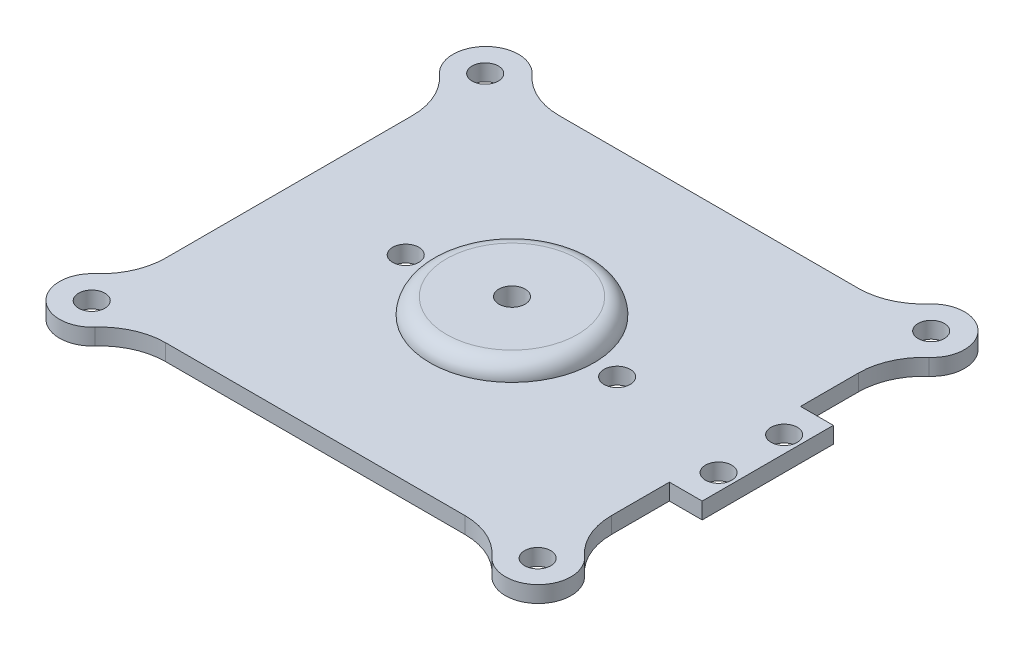
from build123d import *

# Parameters (mm, degrees)
SALIENTE_EXTRUIR1_DEPTH = 5
CROQUIS3_R              = 25
SALIENTE_EXTRUIR2_DEPTH = 5
CORTAR_EXTRUIR1_REACH   = 107.281
CROQUIS4_R              = 4
CORTAR_EXTRUIR2_REACH   = 106.924
CROQUIS5_R              = 4
CORTAR_EXTRUIR8_REACH   = 106.924
CROQUIS12_R             = 4
REDONDEO2_R             = 5


with BuildPart() as part:
    # Croquis1 → Saliente-Extruir1 (new body)
    with BuildSketch(Plane(origin=(0, 0, 0), x_dir=(1, 0, 0), z_dir=(0, 1, 0))):
        with BuildLine():
            Line((78, 60), (78, -60))
            ThreePointArc((78, -60), (75.071067812, -67.071067812), (68, -70))
            Line((68, -70), (-68, -70))
            ThreePointArc((-68, -70), (-75.071067812, -67.071067812), (-78, -60))
            Line((-78, -60), (-78, 60))
            ThreePointArc((-78, 60), (-75.071067812, 67.071067812), (-68, 70))
            Line((-68, 70), (68, 70))
            ThreePointArc((68, 70), (75.071067812, 67.071067812), (78, 60))
        make_face()
    extrude(amount=SALIENTE_EXTRUIR1_DEPTH)

    # Croquis3 → Saliente-Extruir2 (add)
    with BuildSketch(Plane(origin=(0, 5, 0), x_dir=(1, 0, 0), z_dir=(0, 1, 0))):
        with Locations(Location((0, 0, 0), (0, 0, 270))):
            Circle(CROQUIS3_R)
    extrude(amount=SALIENTE_EXTRUIR2_DEPTH)

    # Croquis4 → Cortar-Extruir1 (cut, up to next)
    with BuildSketch(Plane(origin=(0, 10, 0), x_dir=(1, 0, 0), z_dir=(0, 1, 0)), mode=Mode.PRIVATE) as cortar_extruir1_sk1:
        with Locations(Location((0, 0, 0), (0, 0, 270))):
            Circle(CROQUIS4_R)
    cortar_extruir1_tool1 = extrude(cortar_extruir1_sk1.sketch, amount=-CORTAR_EXTRUIR1_REACH, mode=Mode.PRIVATE) & part.part
    add(cortar_extruir1_tool1.solids().sort_by_distance((0, 10, 0))[0], mode=Mode.SUBTRACT)

    # Croquis5 → Cortar-Extruir2 (cut, up to next)
    with BuildSketch(Plane(origin=(0, 5, 0), x_dir=(1, 0, 0), z_dir=(0, 1, 0)), mode=Mode.PRIVATE) as cortar_extruir2_sk1:
        with Locations(Location((-68, -60.171139927, 0), (0, 0, 270))):
            Circle(CROQUIS5_R)
    cortar_extruir2_tool1 = extrude(cortar_extruir2_sk1.sketch, amount=-CORTAR_EXTRUIR2_REACH, mode=Mode.PRIVATE) & part.part
    # Croquis5 → Cortar-Extruir2 (cut, up to next)
    with BuildSketch(Plane(origin=(0, 5, 0), x_dir=(1, 0, 0), z_dir=(0, 1, 0)), mode=Mode.PRIVATE) as cortar_extruir2_sk2:
        with Locations(Location((-68, 59.828860073, 0), (0, 0, 270))):
            Circle(CROQUIS5_R)
    cortar_extruir2_tool2 = extrude(cortar_extruir2_sk2.sketch, amount=-CORTAR_EXTRUIR2_REACH, mode=Mode.PRIVATE) & part.part
    # Croquis5 → Cortar-Extruir2 (cut, up to next)
    with BuildSketch(Plane(origin=(0, 5, 0), x_dir=(1, 0, 0), z_dir=(0, 1, 0)), mode=Mode.PRIVATE) as cortar_extruir2_sk3:
        with Locations(Location((68, -60.171139927, 0), (0, 0, 270))):
            Circle(CROQUIS5_R)
    cortar_extruir2_tool3 = extrude(cortar_extruir2_sk3.sketch, amount=-CORTAR_EXTRUIR2_REACH, mode=Mode.PRIVATE) & part.part
    # Croquis5 → Cortar-Extruir2 (cut, up to next)
    with BuildSketch(Plane(origin=(0, 5, 0), x_dir=(1, 0, 0), z_dir=(0, 1, 0)), mode=Mode.PRIVATE) as cortar_extruir2_sk4:
        with Locations(Location((68, 59.828860073, 0), (0, 0, 270))):
            Circle(CROQUIS5_R)
    cortar_extruir2_tool4 = extrude(cortar_extruir2_sk4.sketch, amount=-CORTAR_EXTRUIR2_REACH, mode=Mode.PRIVATE) & part.part
    # Croquis5 → Cortar-Extruir2 (cut, up to next)
    with BuildSketch(Plane(origin=(0, 5, 0), x_dir=(1, 0, 0), z_dir=(0, 1, 0)), mode=Mode.PRIVATE) as cortar_extruir2_sk5:
        with Locations(Location((32.24, -0.171139927, 0), (0, 0, 270))):
            Circle(CROQUIS5_R)
    cortar_extruir2_tool5 = extrude(cortar_extruir2_sk5.sketch, amount=-CORTAR_EXTRUIR2_REACH, mode=Mode.PRIVATE) & part.part
    # Croquis5 → Cortar-Extruir2 (cut, up to next)
    with BuildSketch(Plane(origin=(0, 5, 0), x_dir=(1, 0, 0), z_dir=(0, 1, 0)), mode=Mode.PRIVATE) as cortar_extruir2_sk6:
        with Locations(Location((-32.24, -0.171139927, 0), (0, 0, 270))):
            Circle(CROQUIS5_R)
    cortar_extruir2_tool6 = extrude(cortar_extruir2_sk6.sketch, amount=-CORTAR_EXTRUIR2_REACH, mode=Mode.PRIVATE) & part.part
    add(cortar_extruir2_tool1.solids().sort_by_distance((-68, 5, 60.17114))[0], mode=Mode.SUBTRACT)
    add(cortar_extruir2_tool2.solids().sort_by_distance((-68, 5, -59.82886))[0], mode=Mode.SUBTRACT)
    add(cortar_extruir2_tool3.solids().sort_by_distance((68, 5, 60.17114))[0], mode=Mode.SUBTRACT)
    add(cortar_extruir2_tool4.solids().sort_by_distance((68, 5, -59.82886))[0], mode=Mode.SUBTRACT)
    add(cortar_extruir2_tool5.solids().sort_by_distance((32.24, 5, 0.17114))[0], mode=Mode.SUBTRACT)
    add(cortar_extruir2_tool6.solids().sort_by_distance((-32.24, 5, 0.17114))[0], mode=Mode.SUBTRACT)

    # Croquis12 → Cortar-Extruir8 (cut, up to next)
    with BuildSketch(Plane(origin=(0, 5, 0), x_dir=(1, 0, 0), z_dir=(0, 1, 0)), mode=Mode.PRIVATE) as cortar_extruir8_sk1:
        with BuildLine():
            Line((68, 70), (-68, 70))
            ThreePointArc((-68, 70), (-63.917517095, 69.128709292), (-60.546440075, 66.666666667))
            ThreePointArc((-60.546440075, 66.666666667), (-53.804286034, 61.742581416), (-45.639320225, 60))
            Line((-45.639320225, 60), (45.639320225, 60))
            ThreePointArc((45.639320225, 60), (53.804286034, 61.742581416), (60.546440075, 66.666666667))
            ThreePointArc((60.546440075, 66.666666667), (63.917517095, 69.128709292), (68, 70))
        make_face()
    cortar_extruir8_tool1 = extrude(cortar_extruir8_sk1.sketch, amount=-CORTAR_EXTRUIR8_REACH, mode=Mode.PRIVATE) & part.part
    # Croquis12 → Cortar-Extruir8 (cut, up to next)
    with BuildSketch(Plane(origin=(0, 5, 0), x_dir=(1, 0, 0), z_dir=(0, 1, 0)), mode=Mode.PRIVATE) as cortar_extruir8_sk2:
        with BuildLine():
            Line((-78, 60), (-78, -60))
            ThreePointArc((-78, -60), (-77.128709292, -55.917517095), (-74.666666667, -52.546440075))
            ThreePointArc((-74.666666667, -52.546440075), (-69.742581416, -45.804286034), (-68, -37.639320225))
            Line((-68, -37.639320225), (-68, 37.639320225))
            ThreePointArc((-68, 37.639320225), (-69.742581416, 45.804286034), (-74.666666667, 52.546440075))
            ThreePointArc((-74.666666667, 52.546440075), (-77.128709292, 55.917517095), (-78, 60))
        make_face()
    cortar_extruir8_tool2 = extrude(cortar_extruir8_sk2.sketch, amount=-CORTAR_EXTRUIR8_REACH, mode=Mode.PRIVATE) & part.part
    # Croquis12 → Cortar-Extruir8 (cut, up to next)
    with BuildSketch(Plane(origin=(0, 5, 0), x_dir=(1, 0, 0), z_dir=(0, 1, 0)), mode=Mode.PRIVATE) as cortar_extruir8_sk3:
        with BuildLine():
            Line((-68, -70), (68, -70))
            ThreePointArc((68, -70), (63.917517095, -69.128709292), (60.546440075, -66.666666667))
            ThreePointArc((60.546440075, -66.666666667), (53.804286034, -61.742581416), (45.639320225, -60))
            Line((45.639320225, -60), (-45.639320225, -60))
            ThreePointArc((-45.639320225, -60), (-53.804286034, -61.742581416), (-60.546440075, -66.666666667))
            ThreePointArc((-60.546440075, -66.666666667), (-63.917517095, -69.128709292), (-68, -70))
        make_face()
    cortar_extruir8_tool3 = extrude(cortar_extruir8_sk3.sketch, amount=-CORTAR_EXTRUIR8_REACH, mode=Mode.PRIVATE) & part.part
    # Croquis12 → Cortar-Extruir8 (cut, up to next)
    with BuildSketch(Plane(origin=(0, 5, 0), x_dir=(1, 0, 0), z_dir=(0, 1, 0)), mode=Mode.PRIVATE) as cortar_extruir8_sk4:
        with BuildLine():
            ThreePointArc((74.666666667, -52.546440075), (77.128709292, -55.917517095), (78, -60))
            Line((78, -60), (78, -20))
            Line((78, -20), (68, -20))
            Line((68, -20), (68, -37.639320225))
            ThreePointArc((68, -37.639320225), (69.742581416, -45.804286034), (74.666666667, -52.546440075))
        make_face()
    cortar_extruir8_tool4 = extrude(cortar_extruir8_sk4.sketch, amount=-CORTAR_EXTRUIR8_REACH, mode=Mode.PRIVATE) & part.part
    # Croquis12 → Cortar-Extruir8 (cut, up to next)
    with BuildSketch(Plane(origin=(0, 5, 0), x_dir=(1, 0, 0), z_dir=(0, 1, 0)), mode=Mode.PRIVATE) as cortar_extruir8_sk5:
        with BuildLine():
            Line((68, 20), (78, 20))
            Line((78, 20), (78, 60))
            ThreePointArc((78, 60), (77.128709292, 55.917517095), (74.666666667, 52.546440075))
            ThreePointArc((74.666666667, 52.546440075), (69.742581416, 45.804286034), (68, 37.639320225))
            Line((68, 37.639320225), (68, 20))
        make_face()
    cortar_extruir8_tool5 = extrude(cortar_extruir8_sk5.sketch, amount=-CORTAR_EXTRUIR8_REACH, mode=Mode.PRIVATE) & part.part
    # Croquis12 → Cortar-Extruir8 (cut, up to next)
    with BuildSketch(Plane(origin=(0, 5, 0), x_dir=(1, 0, 0), z_dir=(0, 1, 0)), mode=Mode.PRIVATE) as cortar_extruir8_sk6:
        with Locations(Location((73, 10, 0), (0, 0, 270))):
            Circle(CROQUIS12_R)
    cortar_extruir8_tool6 = extrude(cortar_extruir8_sk6.sketch, amount=-CORTAR_EXTRUIR8_REACH, mode=Mode.PRIVATE) & part.part
    # Croquis12 → Cortar-Extruir8 (cut, up to next)
    with BuildSketch(Plane(origin=(0, 5, 0), x_dir=(1, 0, 0), z_dir=(0, 1, 0)), mode=Mode.PRIVATE) as cortar_extruir8_sk7:
        with Locations(Location((73, -10, 0), (0, 0, 270))):
            Circle(CROQUIS12_R)
    cortar_extruir8_tool7 = extrude(cortar_extruir8_sk7.sketch, amount=-CORTAR_EXTRUIR8_REACH, mode=Mode.PRIVATE) & part.part
    add(cortar_extruir8_tool1.solids().sort_by_distance((0, 5, -65.214104))[0], mode=Mode.SUBTRACT)
    add(cortar_extruir8_tool2.solids().sort_by_distance((-73.248187, 5, 0))[0], mode=Mode.SUBTRACT)
    add(cortar_extruir8_tool3.solids().sort_by_distance((0, 5, 65.214104))[0], mode=Mode.SUBTRACT)
    add(cortar_extruir8_tool4.solids().sort_by_distance((73.412248, 5, 35.448838))[0], mode=Mode.SUBTRACT)
    add(cortar_extruir8_tool5.solids().sort_by_distance((73.412248, 5, -35.448838))[0], mode=Mode.SUBTRACT)
    add(cortar_extruir8_tool6.solids().sort_by_distance((73, 5, -10))[0], mode=Mode.SUBTRACT)
    add(cortar_extruir8_tool7.solids().sort_by_distance((73, 5, 10))[0], mode=Mode.SUBTRACT)

    # Redondeo2
    redondeo2_edges = [part.edges().sort_by_distance(p)[0] for p in [
        (0, 10, -25),
    ]]
    fillet(redondeo2_edges, radius=REDONDEO2_R - 0.0001)  # a hair under: the kernel refuses the full size


solid = part.part
